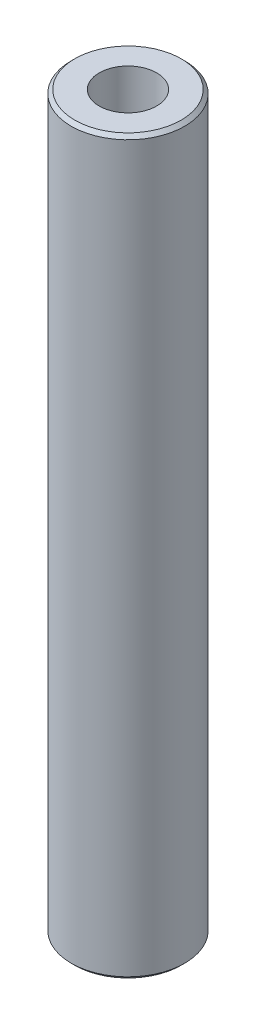
from build123d import *

# Parameters (mm, degrees)
SKETCH1_R           = 32.5
BOSS_EXTRUDE1_DEPTH = 419.354104719
SKETCH2_R           = 16.476301469
CUT_EXTRUDE1_DEPTH  = 422.86534006
CHAMFER1_SIZE       = 2.016413035


with BuildPart() as part:
    # Sketch1 → Boss-Extrude1 (new body)
    with BuildSketch(Plane(origin=(0, 0, 0), x_dir=(1, 0, 0), z_dir=(0, 1, 0))):
        Circle(SKETCH1_R)
    extrude(amount=BOSS_EXTRUDE1_DEPTH)

    # Sketch2 → Cut-Extrude1 (cut, through all)
    with BuildSketch(Plane(origin=(0, 0, 0), x_dir=(1, 0, 0), z_dir=(0, 1, 0))):
        Circle(SKETCH2_R)
    extrude(amount=CUT_EXTRUDE1_DEPTH, mode=Mode.SUBTRACT)

    # Chamfer1
    chamfer1_edges = [part.edges().sort_by_distance(p)[0] for p in [
        (-32.5, 419.354104719, 0),
        (-32.5, 0, 0),
    ]]
    chamfer(chamfer1_edges, length=CHAMFER1_SIZE)


solid = part.part
